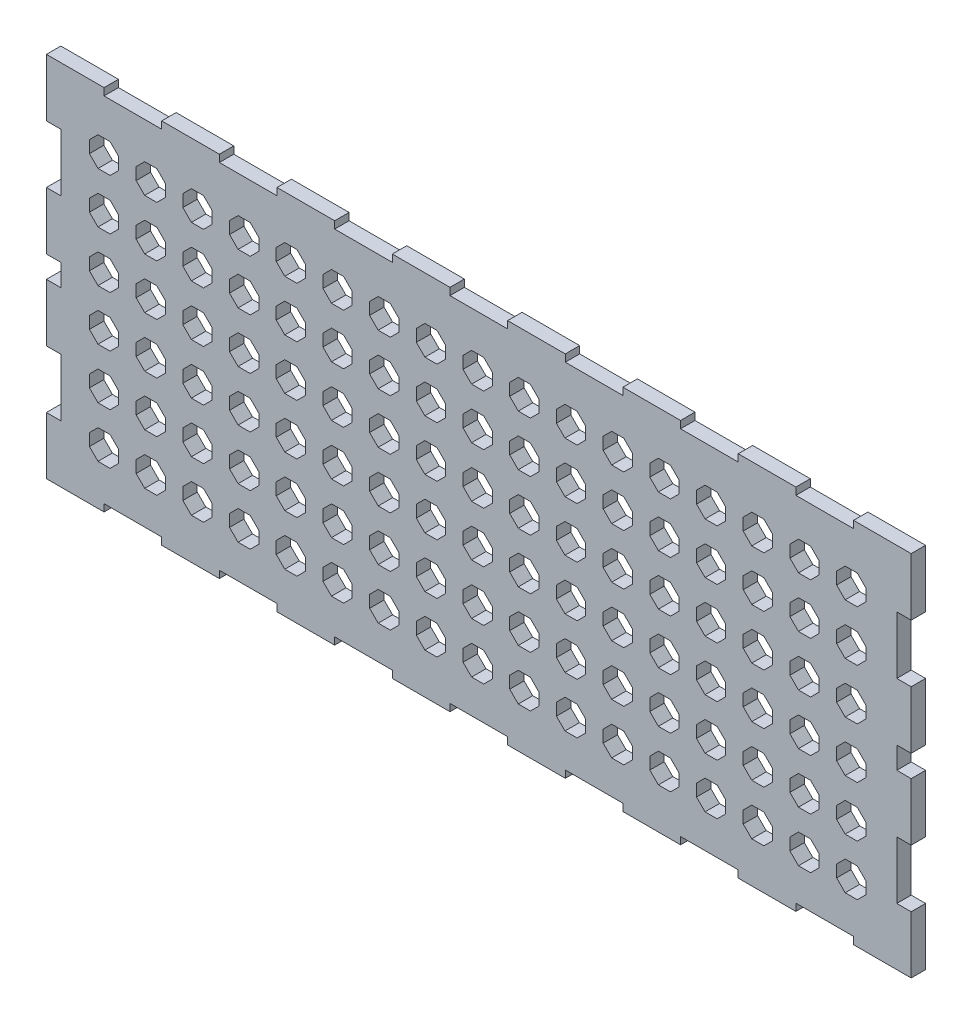
from build123d import *

# Parameters (mm, degrees)
SKETCH1_W               = 190.5
SKETCH1_H               = 80.9625
BOSS_EXTRUDE1_DEPTH     = 3.175
SKETCH2_W               = 3.175
SKETCH2_H               = 12.7
CUT_EXTRUDE1_DEPTH      = 208.01511305
SKETCH3_W               = 3.175
SKETCH3_H               = 4.826
CUT_EXTRUDE2_DEPTH      = 208.01511305
LPATTERN1_COUNT         = 2
LPATTERN1_PITCH         = 42.926
SKETCH4_W               = 12.7
SKETCH4_H               = 1.5875
CUT_EXTRUDE3_DEPTH      = 208.01511305
LPATTERN2_COUNT         = 7
LPATTERN2_PITCH         = 25.4
MIRROR1_COPY_1_SKETCH_W = 12.7
MIRROR1_COPY_1_SKETCH_H = 1.5875
MIRROR1_COPY_1_DEPTH    = 208.01511305
MIRROR1_COPY_2_SKETCH_W = 12.7
MIRROR1_COPY_2_SKETCH_H = 1.5875
MIRROR1_COPY_2_DEPTH    = 208.01511305
MIRROR1_COPY_3_SKETCH_W = 12.7
MIRROR1_COPY_3_SKETCH_H = 1.5875
MIRROR1_COPY_3_DEPTH    = 208.01511305
MIRROR1_COPY_4_SKETCH_W = 12.7
MIRROR1_COPY_4_SKETCH_H = 1.5875
MIRROR1_COPY_4_DEPTH    = 208.01511305
MIRROR1_COPY_5_SKETCH_W = 12.7
MIRROR1_COPY_5_SKETCH_H = 1.5875
MIRROR1_COPY_5_DEPTH    = 208.01511305
MIRROR1_COPY_6_SKETCH_W = 12.7
MIRROR1_COPY_6_SKETCH_H = 1.5875
MIRROR1_COPY_6_DEPTH    = 208.01511305
MIRROR2_COPY_1_SKETCH_W = 3.175
MIRROR2_COPY_1_SKETCH_H = 12.7
MIRROR2_COPY_1_DEPTH    = 208.01511305
CUT_EXTRUDE4_DEPTH      = 208.01511305
LPATTERN5_COUNT         = 17
LPATTERN5_PITCH         = 10.287
LPATTERN5_COUNT_DIR2    = 6
LPATTERN5_PITCH_DIR2    = 11.176


with BuildPart() as part:
    # Sketch1 → Boss-Extrude1 (new body)
    with BuildSketch(Plane.XY):
        with Locations((95.25, -40.48125)):
            Rectangle(SKETCH1_W, SKETCH1_H)
    extrude(amount=BOSS_EXTRUDE1_DEPTH)

    # Sketch2 → Cut-Extrude1 (cut, through all)
    with BuildSketch(Plane.XY.offset(3.175)):
        with Locations((1.5875, -19.05)):
            Rectangle(SKETCH2_W, SKETCH2_H)
    cut_extrude1 = extrude(amount=-CUT_EXTRUDE1_DEPTH, mode=Mode.SUBTRACT)

    # Sketch3 → Cut-Extrude2 (cut, through all)
    with BuildSketch(Plane.XY.offset(3.175)):
        with Locations((1.5875, -40.513)):
            Rectangle(SKETCH3_W, SKETCH3_H)
    cut_extrude2 = extrude(amount=-CUT_EXTRUDE2_DEPTH, mode=Mode.SUBTRACT)

    # LPattern1: Cut-Extrude1 ×2
    with Locations(*[(0, -i * LPATTERN1_PITCH, 0) for i in range(1, LPATTERN1_COUNT)]):
        add(cut_extrude1, mode=Mode.SUBTRACT)

    # Sketch4 → Cut-Extrude3 (cut, through all)
    with BuildSketch(Plane.XY.offset(3.175)):
        with Locations((19.05, -0.79375)):
            Rectangle(SKETCH4_W, SKETCH4_H)
    cut_extrude3 = extrude(amount=-CUT_EXTRUDE3_DEPTH, mode=Mode.SUBTRACT)

    # LPattern2: Cut-Extrude3 ×7
    with Locations(*[(i * LPATTERN2_PITCH, 0, 0) for i in range(1, LPATTERN2_COUNT)]):
        add(cut_extrude3, mode=Mode.SUBTRACT)

    # Mirror1: Cut-Extrude3 across plane
    add(cut_extrude3.mirror(Plane.ZX.offset(-40.48125)), mode=Mode.SUBTRACT)

    # Mirror1 copy 1 sketch → Mirror1 copy 1 (cut, through all)
    with BuildSketch(Plane(origin=(25.4, -80.9625, 3.175), x_dir=(1, 0, 0), z_dir=(0, 0, 1))):
        with Locations((19.05, 0.79375)):
            Rectangle(MIRROR1_COPY_1_SKETCH_W, MIRROR1_COPY_1_SKETCH_H)
    extrude(amount=-MIRROR1_COPY_1_DEPTH, mode=Mode.SUBTRACT)

    # Mirror1 copy 2 sketch → Mirror1 copy 2 (cut, through all)
    with BuildSketch(Plane(origin=(50.8, -80.9625, 3.175), x_dir=(1, 0, 0), z_dir=(0, 0, 1))):
        with Locations((19.05, 0.79375)):
            Rectangle(MIRROR1_COPY_2_SKETCH_W, MIRROR1_COPY_2_SKETCH_H)
    extrude(amount=-MIRROR1_COPY_2_DEPTH, mode=Mode.SUBTRACT)

    # Mirror1 copy 3 sketch → Mirror1 copy 3 (cut, through all)
    with BuildSketch(Plane(origin=(76.2, -80.9625, 3.175), x_dir=(1, 0, 0), z_dir=(0, 0, 1))):
        with Locations((19.05, 0.79375)):
            Rectangle(MIRROR1_COPY_3_SKETCH_W, MIRROR1_COPY_3_SKETCH_H)
    extrude(amount=-MIRROR1_COPY_3_DEPTH, mode=Mode.SUBTRACT)

    # Mirror1 copy 4 sketch → Mirror1 copy 4 (cut, through all)
    with BuildSketch(Plane(origin=(101.6, -80.9625, 3.175), x_dir=(1, 0, 0), z_dir=(0, 0, 1))):
        with Locations((19.05, 0.79375)):
            Rectangle(MIRROR1_COPY_4_SKETCH_W, MIRROR1_COPY_4_SKETCH_H)
    extrude(amount=-MIRROR1_COPY_4_DEPTH, mode=Mode.SUBTRACT)

    # Mirror1 copy 5 sketch → Mirror1 copy 5 (cut, through all)
    with BuildSketch(Plane(origin=(127, -80.9625, 3.175), x_dir=(1, 0, 0), z_dir=(0, 0, 1))):
        with Locations((19.05, 0.79375)):
            Rectangle(MIRROR1_COPY_5_SKETCH_W, MIRROR1_COPY_5_SKETCH_H)
    extrude(amount=-MIRROR1_COPY_5_DEPTH, mode=Mode.SUBTRACT)

    # Mirror1 copy 6 sketch → Mirror1 copy 6 (cut, through all)
    with BuildSketch(Plane(origin=(152.4, -80.9625, 3.175), x_dir=(1, 0, 0), z_dir=(0, 0, 1))):
        with Locations((19.05, 0.79375)):
            Rectangle(MIRROR1_COPY_6_SKETCH_W, MIRROR1_COPY_6_SKETCH_H)
    extrude(amount=-MIRROR1_COPY_6_DEPTH, mode=Mode.SUBTRACT)

    # Mirror2: Cut-Extrude1, Cut-Extrude2 across plane
    add(cut_extrude1.mirror(Plane(origin=(95.25, 0, 0), x_dir=(0, 0, 1), z_dir=(1, 0, 0))), mode=Mode.SUBTRACT)
    add(cut_extrude2.mirror(Plane(origin=(95.25, 0, 0), x_dir=(0, 0, 1), z_dir=(1, 0, 0))), mode=Mode.SUBTRACT)

    # Mirror2 copy 1 sketch → Mirror2 copy 1 (cut, through all)
    with BuildSketch(Plane(origin=(190.5, -42.926, 3.175), x_dir=(-1, 0, 0), z_dir=(0, 0, 1))):
        with Locations((1.5875, 19.05)):
            Rectangle(MIRROR2_COPY_1_SKETCH_W, MIRROR2_COPY_1_SKETCH_H)
    extrude(amount=-MIRROR2_COPY_1_DEPTH, mode=Mode.SUBTRACT)

    # Sketch7 → Cut-Extrude4 (cut, through all)
    with BuildSketch(Plane.XY.offset(3.175)):
        Polygon((15.919353785, -11.535203569), (14.0335, -9.649349784), (11.3665, -9.649349784), (9.480646215, -11.535203569), (9.480646215, -14.202203569), (11.3665, -16.088057354), (14.0335, -16.088057354), (15.919353785, -14.202203569), align=None)
    cut_extrude4 = extrude(amount=-CUT_EXTRUDE4_DEPTH, mode=Mode.SUBTRACT)

    # LPattern5: Cut-Extrude4 17 × 6
    with Locations(*[(i * LPATTERN5_PITCH, -j * LPATTERN5_PITCH_DIR2, 0) for i in range(LPATTERN5_COUNT) for j in range(LPATTERN5_COUNT_DIR2) if (i, j) != (0, 0)]):
        add(cut_extrude4, mode=Mode.SUBTRACT)


solid = part.part
